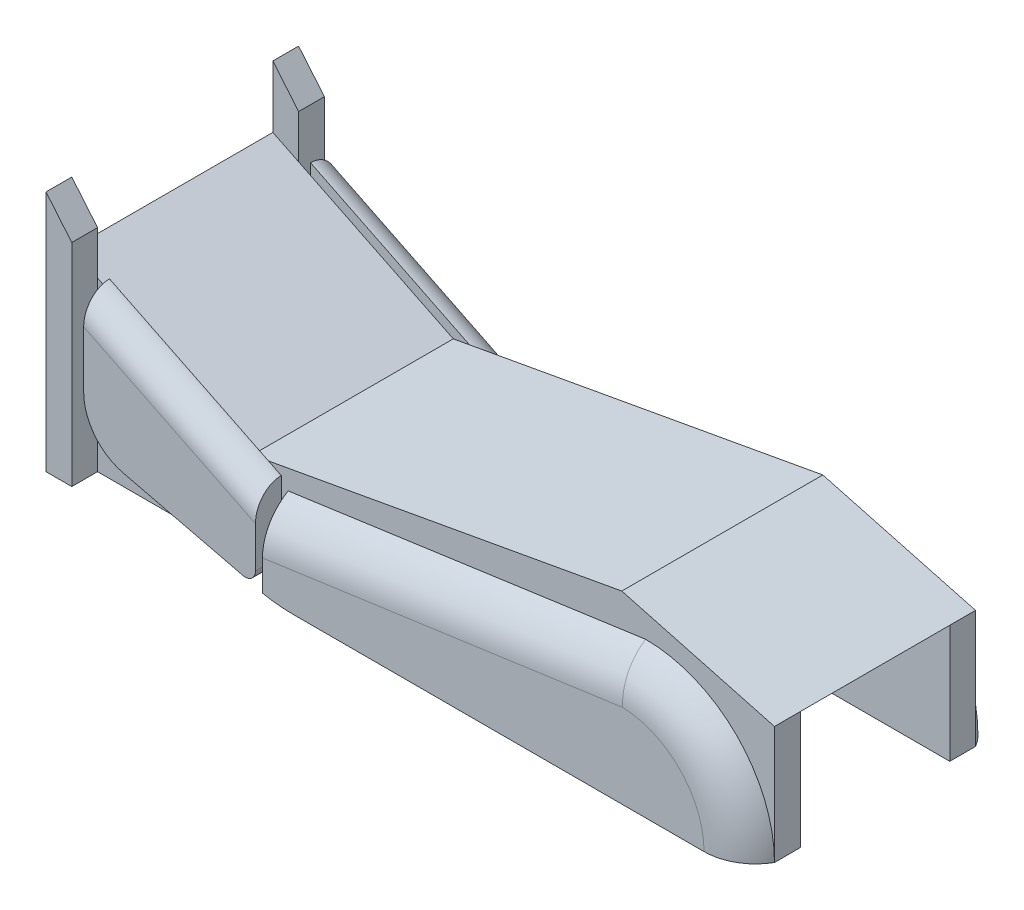
from build123d import *

# Parameters (mm, degrees)
BOSS_EXTRUDE1_DEPTH  = 5
BOSS_EXTRUDE3_DEPTH  = 29
SKETCH7_R            = 2.55
CUT_EXTRUDE1_DEPTH   = 4
BOSS_EXTRUDE4_DEPTH  = 5
CUT_EXTRUDE2_DEPTH   = 50
BOSS_EXTRUDE5_DEPTH  = 39
BOSS_EXTRUDE6_DEPTH  = 5
BOSS_EXTRUDE7_DEPTH  = 5
BOSS_EXTRUDE8_DEPTH  = 5
FILLET1_START        = -96.499038859
FILLET1_DEPTH        = 93.561345122
FILLET1_2_ANGLE      = 90
BOSS_EXTRUDE9_DEPTH  = 5
FILLET2_R            = 10
FILLET3_R            = 5
FILLET4_R            = 2
BOSS_EXTRUDE10_START = 5
BOSS_EXTRUDE10_DEPTH = 5
FILLET5_R            = 10
BOSS_EXTRUDE11_DEPTH = 5
FILLET6_R            = 10
FILLET7_R            = 5
FILLET8_R            = 2


with BuildPart() as part:
    # Sketch1 → Boss-Extrude1 (new body)
    with BuildSketch(Plane.XY):
        Polygon((0, 0), (-101.301402794, 27.143629071), (-101.301402794, -22.856370929), (0, -22.856370929), align=None)
    extrude(amount=BOSS_EXTRUDE1_DEPTH)

    # Sketch3 → Boss-Extrude3 (add)
    with BuildSketch(Plane(origin=(0, 0, 0), x_dir=(-1, 0, 0), z_dir=(0, 0, -1))):
        Polygon((101.301402794, 27.143629071), (101.301402794, -22.856370929), (28.3, -22.856370929), (28.3, 0), (0, 0), align=None)
    extrude(amount=BOSS_EXTRUDE3_DEPTH)

    # Sketch7 → Cut-Extrude1 (cut)
    with BuildSketch(Plane.XZ.offset(22.856370929)):
        with Locations(Location((-38.3, -6.5, 0), (0, 0, 270))):
            Circle(SKETCH7_R)
        with Locations(Location((-38.3, -22.5, 0), (0, 0, 90))):
            Circle(SKETCH7_R)
        with Locations(Location((-94.302805589, -22.5, 0), (0, 0, 270))):
            Circle(SKETCH7_R)
        with Locations(Location((-94.302805589, -6.5, 0), (0, 0, 90))):
            Circle(SKETCH7_R)
    extrude(amount=-CUT_EXTRUDE1_DEPTH, mode=Mode.SUBTRACT)

    # Sketch8 → Boss-Extrude4 (add)
    with BuildSketch(Plane(origin=(0, 0, -29), x_dir=(-1, 0, 0), z_dir=(0, 0, -1))):
        Polygon((0, 0), (0, -22.856370929), (28.3, -22.856370929), (101.301402794, -22.856370929), (101.301402794, 27.143629071), align=None)
    extrude(amount=BOSS_EXTRUDE4_DEPTH)

    # Sketch9 → Cut-Extrude2 (cut)
    with BuildSketch(Plane(origin=(0, 0, -34), x_dir=(-1, 0, 0), z_dir=(0, 0, -1))):
        Polygon((101.301402794, 27.143629071), (29.621530414, 7.937065153), (101.301402794, -5.041318946), align=None)
    extrude(amount=-CUT_EXTRUDE2_DEPTH, mode=Mode.SUBTRACT)

    # Sketch10 → Boss-Extrude5 (add)
    with BuildSketch(Plane.XY.offset(5)):
        Polygon((-101.301402794, -22.856370929), (-136.301402794, -22.856370929), (-136.301402794, 12.143629071), (-101.301402794, -5.041318946), align=None)
    extrude(amount=-BOSS_EXTRUDE5_DEPTH)

    # Sketch11 → Boss-Extrude6 (add)
    with BuildSketch(Plane.XY.offset(5)):
        Polygon((-136.301402794, -22.856370929), (-131.301402794, -22.856370929), (-131.301402794, 18.143473933), (-136.301402794, 24.143629071), align=None)
    extrude(amount=BOSS_EXTRUDE6_DEPTH)

    # Sketch12 → Boss-Extrude7 (add)
    with BuildSketch(Plane(origin=(0, 0, -34), x_dir=(-1, 0, 0), z_dir=(0, 0, -1))):
        Polygon((136.301402794, -22.856370929), (136.301402794, 24.143629071), (131.301402794, 18.143473933), (131.301402794, -22.856370929), align=None)
    extrude(amount=BOSS_EXTRUDE7_DEPTH)

    # Sketch13 → Boss-Extrude8 (add)
    with BuildSketch(Plane.XY.offset(5)):
        with BuildLine():
            ThreePointArc((0, -22.856370929), (-7.32233047, -5.178701399), (-25, 2.143629071))
            Line((-25, 2.143629071), (-94.318764812, -7.598487996))
            Line((-94.318764812, -7.598487996), (-94.318764812, -22.261326085))
            ThreePointArc((-94.318764812, -22.261326085), (-91.360881343, -22.707239046), (-88.373294914, -22.856370929))
            Line((-88.373294914, -22.856370929), (0, -22.856370929))
        make_face()
    extrude(amount=BOSS_EXTRUDE8_DEPTH)

    # Fillet1: read off the stored shape, not the designer's step
    # Fillet1 outline → Fillet1 (cut)
    with BuildSketch(Plane(origin=(0, 0, 0), x_dir=(-0.13917310096006896, 0.9902680687415698, 0), z_dir=(0.9902680687415698, 0.13917310096006896, 0)).offset(FILLET1_START)):
        with BuildLine():
            ThreePointArc((-3.058159094, 10), (1.941840906, 8.660254038), (5.602094944, 5))
            Line((5.602094944, 5), (5.602094944, 10))
            Line((5.602094944, 10), (-3.058159094, 10))
        make_face()
    extrude(amount=FILLET1_DEPTH, mode=Mode.SUBTRACT)

    # Fillet1 2 outline → Fillet1 2 (revolve, cut)
    with BuildSketch(Plane(origin=(-25, -22.856370929, 0), x_dir=(1, 0, 0), z_dir=(0, -1, 0))):
        with BuildLine():
            Line((25, 10), (16.339745962, 10))
            ThreePointArc((16.339745962, 10), (21.339745962, 8.660254038), (25, 5))
            Line((25, 5), (25, 10))
        make_face()
    revolve(axis=Axis((-25, -22.856370929, 0), (0, 0, 1)), revolution_arc=FILLET1_2_ANGLE, mode=Mode.SUBTRACT)

    # Sketch14 → Boss-Extrude9 (add)
    with BuildSketch(Plane.XY.offset(5)):
        Polygon((-128.991070269, 10.697688119), (-95.669410429, -5.689032412), (-95.669410429, -21.784370313), (-128.991070269, -13.724945051), align=None)
    extrude(amount=BOSS_EXTRUDE9_DEPTH)

    # Fillet2
    fillet2_edges = [part.edges().sort_by_distance(p)[0] for p in [
        (-128.991070269, -13.724945051, 7.5),
    ]]
    fillet(fillet2_edges, radius=FILLET2_R)

    # Fillet3
    fillet3_edges = [part.edges().sort_by_distance(p)[0] for p in [
        (-112.330240349, 2.504327853, 10),
    ]]
    fillet(fillet3_edges, radius=FILLET3_R - 0.0001)  # a hair under: the kernel refuses the full size

    # Fillet4
    fillet4_edges = [part.edges().sort_by_distance(p)[0] for p in [
        (-95.669410429, -21.784370313, 7.5),
    ]]
    fillet(fillet4_edges, radius=FILLET4_R)

    # Sketch15 → Boss-Extrude10 (add)
    with BuildSketch(Plane(origin=(0, 0, -34), x_dir=(-1, 0, 0), z_dir=(0, 0, -1)).offset(BOSS_EXTRUDE10_START)):
        with BuildLine():
            Line((88.373294914, -22.856370929), (80, -22.856370929))
            Line((80, -22.856370929), (0, -22.856370929))
            ThreePointArc((0, -22.856370929), (7.32233047, -5.178701399), (25, 2.143629071))
            Line((25, 2.143629071), (94.318764812, -7.598487996))
            Line((94.318764812, -7.598487996), (94.318764812, -22.261326085))
            ThreePointArc((94.318764812, -22.261326085), (91.360881343, -22.707239046), (88.373294914, -22.856370929))
        make_face()
    extrude(amount=-BOSS_EXTRUDE10_DEPTH)

    # Fillet5
    # the kernel refuses this fillet: 10 mm, written as the material it takes off along each edge
    with BuildSketch(Plane(origin=(-3.560067398, 5.156815095, -39), x_dir=(0, 0, 1), z_dir=(-0.9902680687415698, -0.13917310096006932, 0))) as fillet5_piece_1:
        with BuildLine():
            CenterArc((10, -8.660254038), FILLET5_R, 120, 60)
            Line((0, -8.660254038), (0, 0))
            Line((0, 0), (5, 0))
        make_face()
    extrude(amount=113.301270189, mode=Mode.SUBTRACT)
    # the kernel refuses this fillet: 10 mm, written as the material it takes off along each edge
    with BuildSketch(Plane(origin=(-25, -22.856370929, -39), x_dir=(0.6477837249350054, -0.7618242879492156, 0), z_dir=(-0.7618242879492156, -0.6477837249350054, 0))) as fillet5_2_piece_1:
        with BuildLine():
            CenterArc((16.339745962, 10), FILLET5_R, 270, 60)
            Line((25, 5), (25, 0))
            Line((25, 0), (16.339745962, 0))
        make_face()
    revolve(axis=Axis((-25, -22.856370929, -39), (0, 0, 1)), revolution_arc=147.330675393, mode=Mode.SUBTRACT)

    # Sketch16 → Boss-Extrude11 (add)
    with BuildSketch(Plane(origin=(0, 0, -34), x_dir=(-1, 0, 0), z_dir=(0, 0, -1))):
        Polygon((128.991070269, 10.697688119), (95.669410429, -5.689032412), (95.669410429, -21.784370313), (128.991070269, -13.724945051), align=None)
    extrude(amount=BOSS_EXTRUDE11_DEPTH)

    # Fillet6
    fillet6_edges = [part.edges().sort_by_distance(p)[0] for p in [
        (-128.991070269, -13.724945051, -36.5),
    ]]
    fillet(fillet6_edges, radius=FILLET6_R)

    # Fillet7
    fillet7_edges = [part.edges().sort_by_distance(p)[0] for p in [
        (-112.330240349, 2.504327853, -39),
    ]]
    fillet(fillet7_edges, radius=FILLET7_R - 0.0001)  # a hair under: the kernel refuses the full size

    # Fillet8
    fillet8_edges = [part.edges().sort_by_distance(p)[0] for p in [
        (-95.669410429, -21.784370313, -36.5),
    ]]
    fillet(fillet8_edges, radius=FILLET8_R)


solid = part.part
